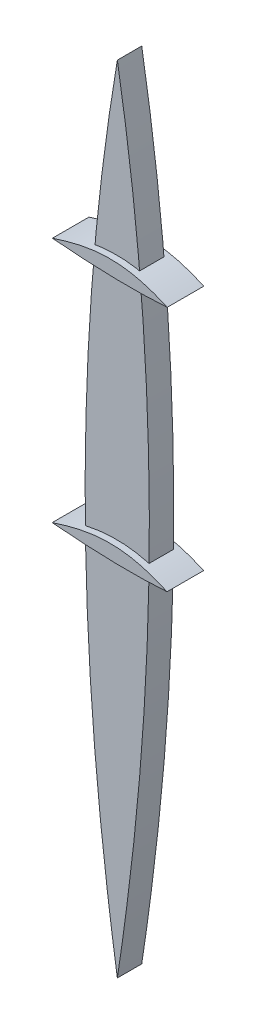
from build123d import *

# Parameters (mm, degrees)
BOSS_EXTRUDE1_DEPTH      = 2.54
BOSS_EXTRUDE2_DEPTH      = 3.81
BOSS_EXTRUDE4_DEPTH      = 1.27
BOSS_EXTRUDE4_DEPTH_BACK = 2.54
SCALE3_START             = -28.574810428
SCALE3_DEPTH             = 60.96
SCALE3_START_2           = -28.574810435
SCALE3_2_DEPTH           = 60.96
SCALE3_START_3           = -19.05
SCALE3_3_DEPTH           = 40.64


# Read off the part's stored shape, not the designer's step: Scale3
with BuildPart() as part:
    # Sketch1 → Boss-Extrude1 (new body)
    with BuildSketch(Plane.XY):
        with BuildLine():
            add(Edge.make_bspline(
                [(0, 42.428687582), (6.664134239, 3.146603919), (0, -40.355383477)],
                knots=[0, 0, 0, 1, 1, 1], degree=2))
            add(Edge.make_bspline(
                [(0, 42.428687582), (-6.714312311, 3.018803659), (0, -40.355383477)],
                knots=[0, 0, 0, 1, 1, 1], degree=2))
        make_face()
    extrude(amount=BOSS_EXTRUDE1_DEPTH)

    # Scale3 3 outline → Scale3 3 (add)
    with BuildSketch(Plane.XY.offset(SCALE3_START_3)):
        with BuildLine():
            add(Edge.make_bspline(
                [(0.150569385, 657.1767414), (106.776717215, 28.663402798), (0.150569385, -667.368395536)],
                knots=[0, 0, 0, 1, 1, 1], degree=2))
            add(Edge.make_bspline(
                [(0.150569385, 657.1767414), (-107.278427592, 26.618598636), (0.150569385, -667.368395536)],
                knots=[0, 0, 0, 1, 1, 1], degree=2))
        make_face()
    extrude(amount=SCALE3_3_DEPTH)


with BuildPart() as body_2:
    # Sketch2 → Boss-Extrude2 (new body)
    with BuildSketch(Plane(origin=(0, 1.555120755, 0), x_dir=(1, 0, 0), z_dir=(0, 0, 1))):
        with BuildLine():
            add(Edge.make_bspline(
                [(-5.69255125, 359.571616655), (-1.210388352, 361.080463571), (2.055889185, 361.231341172), (6.27177182, 359.323099559)],
                knots=[0, 0, 0, 0, 1, 1, 1, 1], degree=3))
            add(Edge.make_bspline(
                [(-5.69255125, 359.571616655), (1.257055878, 358.968075421), (6.27177182, 359.323099559)],
                knots=[0, 0, 0, 1, 1, 1], degree=2))
        make_face()
    extrude(amount=BOSS_EXTRUDE2_DEPTH)

    # Scale3 outline → Scale3 (add)
    with BuildSketch(Plane.XY.offset(SCALE3_START)):
        with BuildLine():
            add(Edge.make_bspline(
                [(94.079482737, 352.801766385), (26.625360582, 383.333632203), (-25.63508001, 380.919590587), (-97.34968638, 356.778039928)],
                knots=[0, 0, 0, 0, 1, 1, 1, 1], degree=3))
            add(Edge.make_bspline(
                [(-97.34968638, 356.778039928), (13.844027658, 347.121380185), (94.079482737, 352.801766385)],
                knots=[0, 0, 0, 1, 1, 1], degree=2))
        make_face()
    extrude(amount=SCALE3_DEPTH)


with BuildPart() as body_3:
    # Sketch4 → Boss-Extrude4 (new, two sides: drawn at the far end of the back side and taken through both)
    with BuildSketch(Plane(origin=(0.757083365, -8.201038142, 2.54), x_dir=(1, 0, 0), z_dir=(0, 0, 1)).offset(-BOSS_EXTRUDE4_DEPTH_BACK)):
        with BuildLine():
            add(Edge.make_bspline(
                [(-6.762619041, -41.227251572), (-2.280456143, -39.718404656), (0.985821394, -39.567527055), (5.201704029, -41.475768668)],
                knots=[0, 0, 0, 0, 1, 1, 1, 1], degree=3))
            add(Edge.make_bspline(
                [(-6.762619041, -41.227251572), (0.186988086, -41.830792806), (5.201704029, -41.475768668)],
                knots=[0, 0, 0, 1, 1, 1], degree=2))
        make_face()
    extrude(amount=BOSS_EXTRUDE4_DEPTH + BOSS_EXTRUDE4_DEPTH_BACK)

    # Scale3 2 outline → Scale3 2 (add)
    with BuildSketch(Plane.XY.offset(SCALE3_START_2)):
        with BuildLine():
            add(Edge.make_bspline(
                [(93.768563702, -57.753788671), (26.314441548, -27.221922853), (-25.945999045, -29.635964469), (-97.660605414, -53.777515128)],
                knots=[0, 0, 0, 0, 1, 1, 1, 1], degree=3))
            add(Edge.make_bspline(
                [(-97.660605414, -53.777515128), (13.533108624, -63.434174871), (93.768563702, -57.753788671)],
                knots=[0, 0, 0, 1, 1, 1], degree=2))
        make_face()
    extrude(amount=SCALE3_2_DEPTH)


solid = Compound([part.part, body_2.part, body_3.part])
